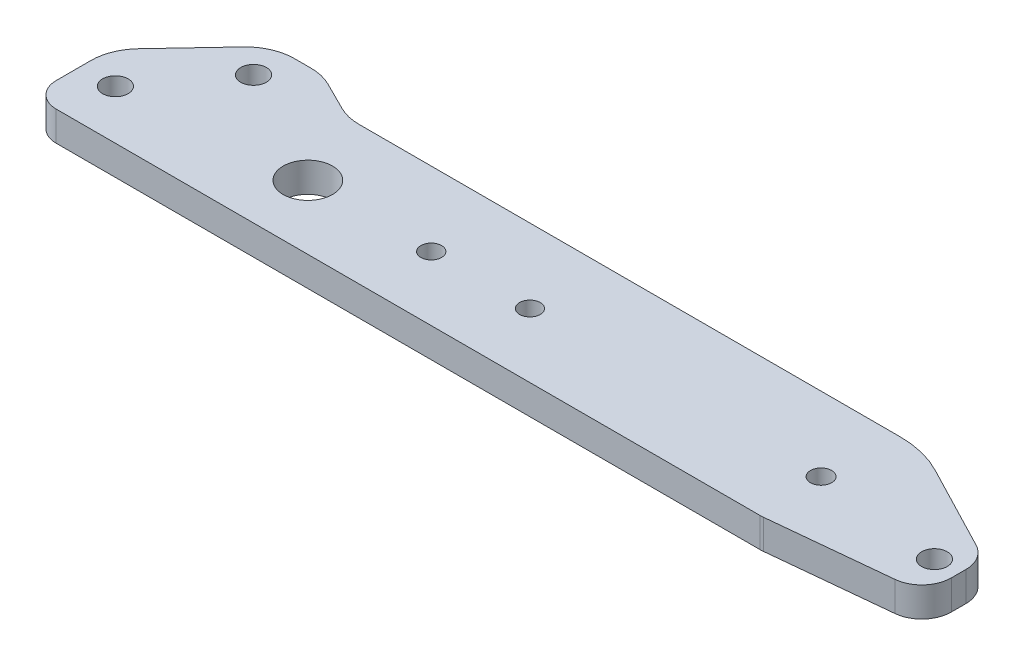
from build123d import *

# Parameters (mm, degrees)
SKETCH1_R           = 2.6
SKETCH1_R_2         = 2.15
SKETCH1_R_3         = 5
SKETCH1_R_4         = 2.1
BOSS_EXTRUDE1_DEPTH = 6
FILLET1_R           = 5
FILLET2_R           = 6
FILLET3_R           = 10
FILLET4_R           = 20
FILLET5_R           = 10


with BuildPart() as part:
    # Sketch1 → Boss-Extrude1 (new body)
    with BuildSketch(Plane(origin=(0, 0, 0), x_dir=(1, 0, 0), z_dir=(0, 1, 0))):
        Polygon((159.965380006, 15), (134.965380006, 28), (18, 28), (8, 33), (-2, 33), (-18, 16), (-18, 0), (0, 0), (129.965380006, 0), (159.965380006, 3), align=None)
        with Locations(Location((-11, 10, 0), (0, 0, 270))):
            Circle(SKETCH1_R, mode=Mode.SUBTRACT)
        with Locations(Location((129, 13, 0), (0, 0, 270))):
            Circle(SKETCH1_R_2, mode=Mode.SUBTRACT)
        with Locations(Location((25, 13, 0), (0, 0, 270))):
            Circle(SKETCH1_R_3, mode=Mode.SUBTRACT)
        with Locations(Location((154.965380006, 10, 0), (0, 0, 270))):
            Circle(SKETCH1_R, mode=Mode.SUBTRACT)
        with Locations(Location((1, 26, 0), (0, 0, 270))):
            Circle(SKETCH1_R, mode=Mode.SUBTRACT)
        with Locations(Location((50, 13, 0), (0, 0, 270))):
            Circle(SKETCH1_R_4, mode=Mode.SUBTRACT)
        with Locations(Location((70, 13, 0), (0, 0, 270))):
            Circle(SKETCH1_R_4, mode=Mode.SUBTRACT)
    extrude(amount=BOSS_EXTRUDE1_DEPTH)

    # Fillet1
    fillet1_edges = [part.edges().sort_by_distance(p)[0] for p in [
        (-18, 3, 0),
    ]]
    fillet(fillet1_edges, radius=FILLET1_R)

    # Fillet2
    # the kernel refuses this fillet: 6 mm, written as the material it takes off along each edge
    with BuildSketch(Plane(origin=(159.965380006, -9.106803364, -15), x_dir=(0, 0, 1), z_dir=(0, 1, 0))) as fillet2_piece_1:
        with BuildLine():
            CenterArc((FILLET2_R * 0.607120224288, -FILLET2_R), FILLET2_R, 90, 62.525568374)
            Line((-FILLET2_R * 0.280096576946, -FILLET2_R * 0.538647263358), (0, 0))
            Line((0, 0), (FILLET2_R * 0.607120224288, 0))
        make_face()
    extrude(amount=24.213606729, mode=Mode.SUBTRACT)
    with BuildSketch(Plane(origin=(159.965380006, -13.574813432, -3), x_dir=(-0.9950371902099892, 0, 0.0995037190209987), z_dir=(0, 1, 0))) as fillet2_piece_2:
        with BuildLine():
            CenterArc((FILLET2_R * 0.904987562112, -FILLET2_R), FILLET2_R, 90, 84.289406863)
            Line((-FILLET2_R * 0.0900496280979, -FILLET2_R * 0.900496280979), (0, 0))
            Line((0, 0), (FILLET2_R * 0.904987562112, 0))
        make_face()
    extrude(amount=33.149626863, mode=Mode.SUBTRACT)
    with BuildSketch(Plane(origin=(129.965380006, -0.748134317, 0), x_dir=(-1, 0, 0), z_dir=(0, 1, 0))) as fillet2_piece_3:
        with BuildLine():
            CenterArc((FILLET2_R * 0.0498756211209, -FILLET2_R), FILLET2_R, 90, 5.710593137)
            Line((-FILLET2_R * 0.0496280979001, -FILLET2_R * 0.00496280979001), (0, 0))
            Line((0, 0), (FILLET2_R * 0.0498756211209, 0))
        make_face()
    extrude(amount=7.496268634, mode=Mode.SUBTRACT)

    # Fillet3
    fillet3_edges = [part.edges().sort_by_distance(p)[0] for p in [
        (-18, 3, -16),
        (-2, 3, -33),
    ]]
    fillet(fillet3_edges, radius=FILLET3_R)

    # Fillet4
    fillet4_edges = [part.edges().sort_by_distance(p)[0] for p in [
        (134.965380006, 3, -28),
    ]]
    fillet(fillet4_edges, radius=FILLET4_R)

    # Fillet5
    fillet5_edges = [part.edges().sort_by_distance(p)[0] for p in [
        (8, 3, -33),
        (18, 3, -28),
    ]]
    fillet(fillet5_edges, radius=FILLET5_R)


solid = part.part
